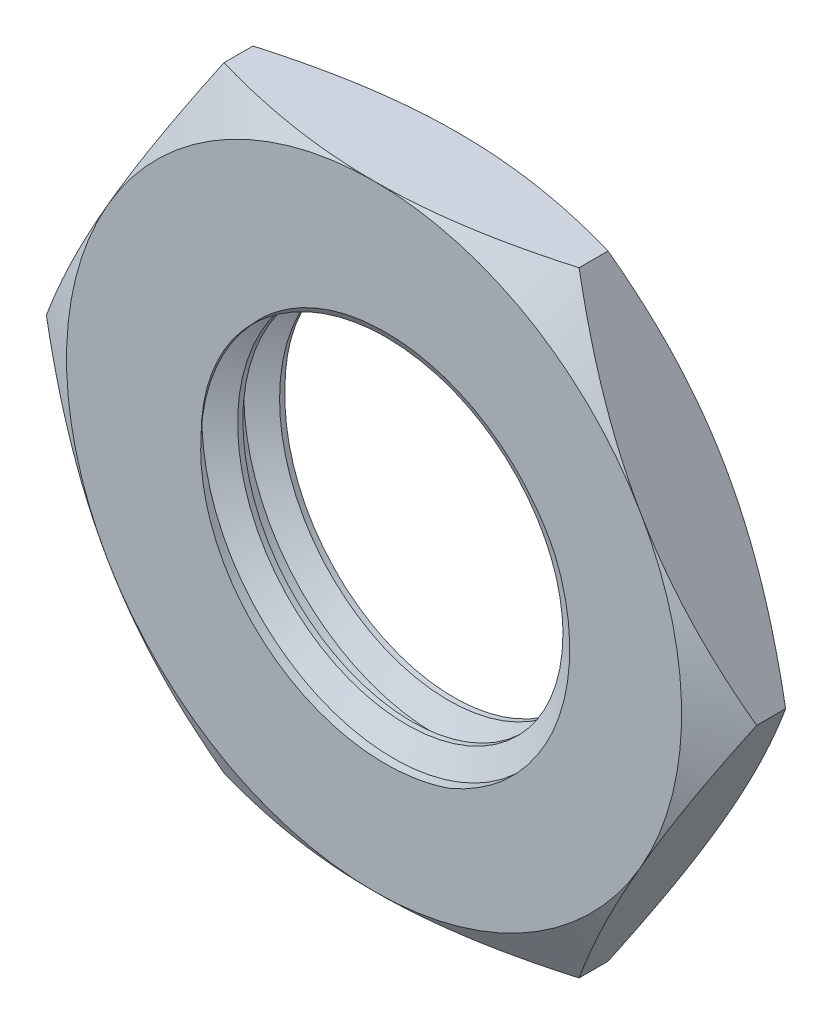
from build123d import *

# Parameters (mm, degrees)
BOSS_EXTRU_1_CONTOUR_CROU_M14_DEPTH    = 1.5
ENL_V_MAT_EXTRU_2_TAP_DRILL_HOLE_REACH = 19.068
TAP_DRILL_HOLE_R                       = 6.188
COINS_RONDS_OUTSIDE_W                  = 68.792
COINS_RONDS_OUTSIDE_H                  = 65.388
COINS_RONDS_OUTSIDE_R                  = 11
ENL_V_MAT_EXTRU_1_COINS_RONDS_DEPTH    = 10
ENL_V_MAT_EXTRU_1_COINS_RONDS_DRAFT    = -60
SYM_TRIE1_COINS_RONDS_COPY_1_SKETCH_W  = 68.792
SYM_TRIE1_COINS_RONDS_COPY_1_SKETCH_H  = 65.388
SYM_TRIE1_COINS_RONDS_COPY_1_SKETCH_R  = 11
SYM_TRIE1_COINS_RONDS_COPY_1_DEPTH     = 10
SYM_TRIE1_COINS_RONDS_COPY_1_DRAFT     = -60
ENL_VEMENT_DE_MATI_RE_BALAYAGE1_PITCH  = 1.5


with BuildPart() as part:
    # Contour_écrou_M14 → Boss.-Extru.1_Contour_écrou_M14 (new, symmetric)
    with BuildSketch(Plane.XY):
        Polygon((12.701705922, 0), (6.350852961, 11), (-6.350852961, 11), (-12.701705922, 0), (-6.350852961, -11), (6.350852961, -11), align=None)
    extrude(amount=BOSS_EXTRU_1_CONTOUR_CROU_M14_DEPTH, both=True)

    # Tap_Drill_Hole → Enlèv. mat.-Extru.2_Tap_Drill_Hole (cut, up to next)
    with BuildSketch(Plane(origin=(0, 0, -1.5), x_dir=(-1, 0, 0), z_dir=(0, 0, -1)), mode=Mode.PRIVATE) as enl_v_mat_extru_2_tap_drill_hole_sk1:
        Circle(TAP_DRILL_HOLE_R)
    enl_v_mat_extru_2_tap_drill_hole_tool1 = extrude(enl_v_mat_extru_2_tap_drill_hole_sk1.sketch, amount=-ENL_V_MAT_EXTRU_2_TAP_DRILL_HOLE_REACH, mode=Mode.PRIVATE) & part.part
    add(enl_v_mat_extru_2_tap_drill_hole_tool1.solids().sort_by_distance((0, 0, -1.5))[0], mode=Mode.SUBTRACT)


with BuildPart() as enl_v_mat_extru_1_coins_ronds_tool:
    # Coins ronds outside → Enlèv. mat.-Extru.1_Coins ronds (with draft: the straight prism first)
    with BuildSketch(Plane(origin=(0, 0, -1.5), x_dir=(-1, 0, 0), z_dir=(0, 0, -1))):
        Rectangle(COINS_RONDS_OUTSIDE_W, COINS_RONDS_OUTSIDE_H)
        Circle(COINS_RONDS_OUTSIDE_R, mode=Mode.SUBTRACT)
    extrude(amount=-ENL_V_MAT_EXTRU_1_COINS_RONDS_DEPTH)
    # Enlèv. mat.-Extru.1_Coins ronds: the draft: its side faces are tilted about the plane it starts from
    enl_v_mat_extru_1_coins_ronds_sides = [enl_v_mat_extru_1_coins_ronds_tool.faces().sort_by_distance(p)[0] for p in [
        (0, -32.694, 3.5),
        (-34.396, 0, 3.5),
        (0, 32.694, 3.5),
        (34.396, 0, 3.5),
        (11, 0, 3.5),
    ]]
    draft(enl_v_mat_extru_1_coins_ronds_sides, Plane(origin=(0, 0, -1.5), x_dir=(-1, 0, 0), z_dir=(0, 0, -1)), ENL_V_MAT_EXTRU_1_COINS_RONDS_DRAFT)


with BuildPart() as part_1:
    add(part.part)

    # Enlèv. mat.-Extru.1_Coins ronds: cut by enl_v_mat_extru_1_coins_ronds_tool
    add(enl_v_mat_extru_1_coins_ronds_tool.part, mode=Mode.SUBTRACT)


with BuildPart() as sym_trie1_coins_ronds_copy_1_tool:
    # Symétrie1_Coins ronds copy 1 sketch → Symétrie1_Coins ronds copy 1 (with draft: the straight prism first)
    with BuildSketch(Plane(origin=(0, 0, 1.5), x_dir=(-1, 0, 0), z_dir=(0, 0, 1))):
        Rectangle(SYM_TRIE1_COINS_RONDS_COPY_1_SKETCH_W, SYM_TRIE1_COINS_RONDS_COPY_1_SKETCH_H)
        Circle(SYM_TRIE1_COINS_RONDS_COPY_1_SKETCH_R, mode=Mode.SUBTRACT)
    extrude(amount=-SYM_TRIE1_COINS_RONDS_COPY_1_DEPTH)
    # Symétrie1_Coins ronds copy 1: the draft: its side faces are tilted about the plane it starts from
    sym_trie1_coins_ronds_copy_1_sides = [sym_trie1_coins_ronds_copy_1_tool.faces().sort_by_distance(p)[0] for p in [
        (0, -32.694, -3.5),
        (-34.396, 0, -3.5),
        (0, 32.694, -3.5),
        (34.396, 0, -3.5),
        (11, 0, -3.5),
    ]]
    draft(sym_trie1_coins_ronds_copy_1_sides, Plane(origin=(0, 0, 1.5), x_dir=(-1, 0, 0), z_dir=(0, 0, 1)), SYM_TRIE1_COINS_RONDS_COPY_1_DRAFT)


with BuildPart() as part_2:
    add(part_1.part)

    # Symétrie1_Coins ronds copy 1: cut by sym_trie1_coins_ronds_copy_1_tool
    add(sym_trie1_coins_ronds_copy_1_tool.part, mode=Mode.SUBTRACT)

    # Enlèvement de matière-Balayage1: the profile of Dents profile screwed along a right-hand helix of 5 turns, 8 arcs to a turn; built about Z, then put on its axis
    enl_vement_de_mati_re_balayage1_z = Axis((0, 0, 0), (0, 0, 1))
    enl_vement_de_mati_re_balayage1_corners = [(6.1877, 0, -1.312790042), (6.1877, 0, 0.000173205), (7, 0, -0.468808419), (7, 0, -0.843808419)]
    with BuildLine(mode=Mode.PRIVATE) as enl_vement_de_mati_re_balayage1_profile:
        Line(enl_vement_de_mati_re_balayage1_corners[0], enl_vement_de_mati_re_balayage1_corners[1])
        Line(enl_vement_de_mati_re_balayage1_corners[1], enl_vement_de_mati_re_balayage1_corners[2])
        Line(enl_vement_de_mati_re_balayage1_corners[2], enl_vement_de_mati_re_balayage1_corners[3])
        Line(enl_vement_de_mati_re_balayage1_corners[3], enl_vement_de_mati_re_balayage1_corners[0])
    enl_vement_de_mati_re_balayage1_cap = Face(enl_vement_de_mati_re_balayage1_profile.wire())
    enl_vement_de_mati_re_balayage1_turn_angles = [0, 22.5, 45, 67.5, 90, 112.5, 135, 157.5, 180, 202.5, 225, 247.5, 270, 292.5, 315, 337.5, 360]
    enl_vement_de_mati_re_balayage1_turn_weights = [1, 0.9238795325112867, 1, 0.9238795325112867, 1, 0.9238795325112867, 1, 0.9238795325112867, 1, 0.9238795325112867, 1, 0.9238795325112867, 1, 0.9238795325112867, 1, 0.9238795325112867, 1]
    enl_vement_de_mati_re_balayage1_turn_rails = [Edge.make_bspline([Vector(p[0], p[1], 0).rotate(enl_vement_de_mati_re_balayage1_z, enl_vement_de_mati_re_balayage1_turn_angles[k]) / enl_vement_de_mati_re_balayage1_turn_weights[k] + Vector(0, 0, p[2] + ENL_VEMENT_DE_MATI_RE_BALAYAGE1_PITCH * enl_vement_de_mati_re_balayage1_turn_angles[k] / 360) for k in range(17)], [0, 0, 0, 1, 1, 2, 2, 3, 3, 4, 4, 5, 5, 6, 6, 7, 7, 8, 8, 8], 2, enl_vement_de_mati_re_balayage1_turn_weights) for p in enl_vement_de_mati_re_balayage1_corners]
    enl_vement_de_mati_re_balayage1_turn_sides = [Face.make_surface_from_curves(enl_vement_de_mati_re_balayage1_turn_rails[p[0]], enl_vement_de_mati_re_balayage1_turn_rails[p[1]]) for p in [(0, 1), (1, 2), (2, 3), (3, 0)]]
    enl_vement_de_mati_re_balayage1 = Plane(origin=(0, 0, -1.5), x_dir=(-1, 0, 0), z_dir=(0, 0, 1)) * Solid(Shell([*[p.moved(Location((0, 0, ENL_VEMENT_DE_MATI_RE_BALAYAGE1_PITCH * i))) for i in range(5) for p in enl_vement_de_mati_re_balayage1_turn_sides], enl_vement_de_mati_re_balayage1_cap, enl_vement_de_mati_re_balayage1_cap.rotate(enl_vement_de_mati_re_balayage1_z, 1800).moved(Location((0, 0, ENL_VEMENT_DE_MATI_RE_BALAYAGE1_PITCH * 1800 / 360)))]))
    add(enl_vement_de_mati_re_balayage1, mode=Mode.SUBTRACT)


solid = part_2.part
